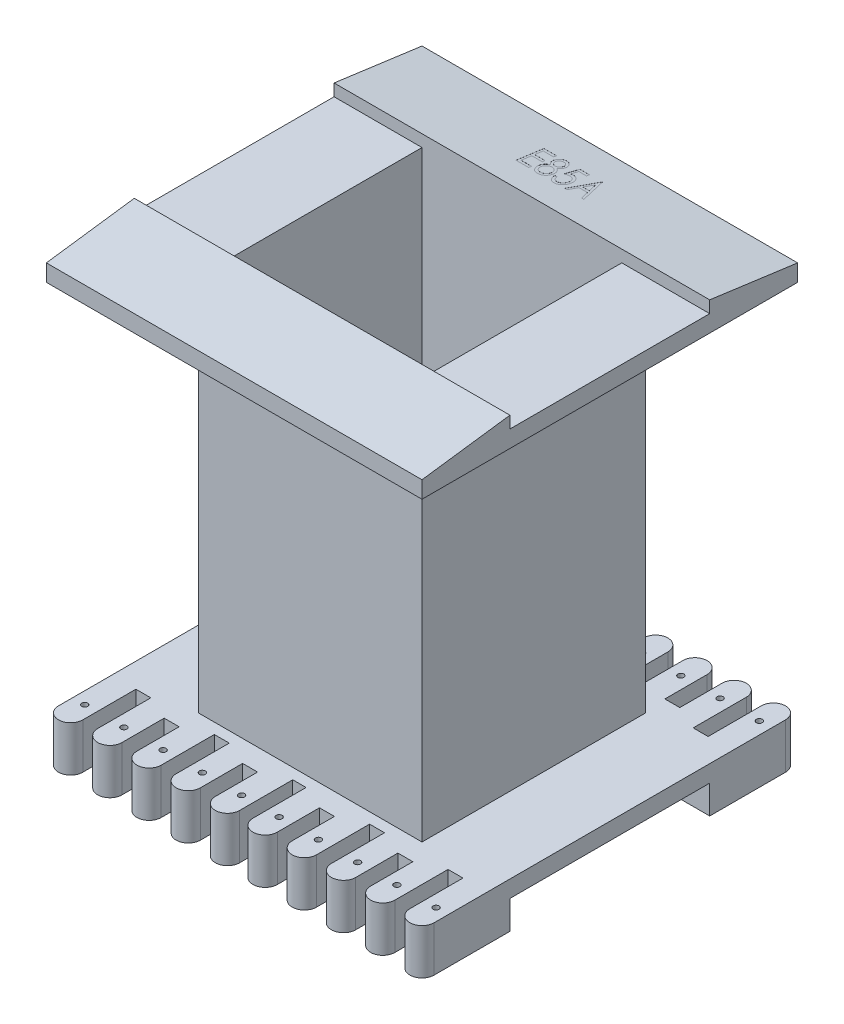
from build123d import *

# Parameters (mm, degrees)
SKETCH2_W           = 31.8
SKETCH2_H           = 31.8
SKETCH2_W_2         = 28.4
SKETCH2_H_2         = 28.4
BOSS_EXTRUDE1_DEPTH = 26.5
SKETCH4_W           = 53.4
SKETCH4_H           = 53.4
SKETCH4_W_2         = 28.4
SKETCH4_H_2         = 28.4
BOSS_EXTRUDE2_DEPTH = 2.4
BOSS_EXTRUDE3_DEPTH = 26.7
SKETCH7_R           = 0.425
CUT_EXTRUDE1_DEPTH  = 3
BOSS_EXTRUDE4_START = 4.05
BOSS_EXTRUDE4_DEPTH = 4.05
CUT_EXTRUDE2_DEPTH  = 0.01


with BuildPart() as part:
    # Sketch2 → Boss-Extrude1 (new, symmetric)
    with BuildSketch(Plane(origin=(0, 0, 0), x_dir=(1, 0, 0), z_dir=(0, 1, 0))):
        Rectangle(SKETCH2_W, SKETCH2_H)
        Rectangle(SKETCH2_W_2, SKETCH2_H_2, mode=Mode.SUBTRACT)
    extrude(amount=BOSS_EXTRUDE1_DEPTH, both=True)

    # Sketch4 → Boss-Extrude2 (add)
    with BuildSketch(Plane(origin=(0, 26.5, 0), x_dir=(1, 0, 0), z_dir=(0, 1, 0))):
        Rectangle(SKETCH4_W, SKETCH4_H)
        Rectangle(SKETCH4_W_2, SKETCH4_H_2, mode=Mode.SUBTRACT)
    boss_extrude2 = extrude(amount=BOSS_EXTRUDE2_DEPTH)

    # Mirror1: Boss-Extrude2 across plane
    add(boss_extrude2.mirror(Plane.ZX))

    # Sketch5 → Boss-Extrude3 (add, symmetric)
    with BuildSketch(Plane(origin=(0, 0, 0), x_dir=(0, 0, -1), z_dir=(1, 0, 0))):
        Polygon((-26.7, 28.9), (-14.2, 30.6), (-14.2, 28.9), align=None)
        Polygon((14.2, 30.6), (14.2, 28.9), (26.7, 28.9), align=None)
    extrude(amount=BOSS_EXTRUDE3_DEPTH, both=True)

    # Sketch7 → Cut-Extrude1 (cut)
    with BuildSketch(Plane.XZ.offset(28.9)):
        with Locations((-24.975, 22.975)):
            Circle(SKETCH7_R)
        with Locations((-19.4, 22.975)):
            Circle(SKETCH7_R)
        with Locations((-13.825, 22.975)):
            Circle(SKETCH7_R)
        with Locations((-8.25, 22.975)):
            Circle(SKETCH7_R)
        with Locations((-2.675, 22.975)):
            Circle(SKETCH7_R)
        with Locations((19.4, 22.975)):
            Circle(SKETCH7_R)
        with Locations((13.825, 22.975)):
            Circle(SKETCH7_R)
        with Locations((8.25, 22.975)):
            Circle(SKETCH7_R)
        with Locations((2.675, 22.975)):
            Circle(SKETCH7_R)
        with Locations((24.975, 22.975)):
            Circle(SKETCH7_R)
        with Locations((24.975, -22.975)):
            Circle(SKETCH7_R)
        with Locations((2.675, -22.975)):
            Circle(SKETCH7_R)
        with Locations((8.25, -22.975)):
            Circle(SKETCH7_R)
        with Locations((13.825, -22.975)):
            Circle(SKETCH7_R)
        with Locations((19.4, -22.975)):
            Circle(SKETCH7_R)
        with Locations((-2.675, -22.975)):
            Circle(SKETCH7_R)
        with Locations((-8.25, -22.975)):
            Circle(SKETCH7_R)
        with Locations((-13.825, -22.975)):
            Circle(SKETCH7_R)
        with Locations((-19.4, -22.975)):
            Circle(SKETCH7_R)
        with Locations((-24.975, -22.975)):
            Circle(SKETCH7_R)
        with BuildLine():
            Line((-26.7, 26.7), (-26.7, 24.975))
            ThreePointArc((-26.7, 24.975), (-24.975, 26.7), (-23.25, 24.975))
            Line((-23.25, 24.975), (-23.25, 17.425))
            Line((-23.25, 17.425), (-21.125, 17.425))
            Line((-21.125, 17.425), (-21.125, 24.975))
            ThreePointArc((-21.125, 24.975), (-19.4, 26.7), (-17.675, 24.975))
            Line((-17.675, 24.975), (-17.675, 18.975))
            Line((-17.675, 18.975), (-15.55, 18.975))
            Line((-15.55, 18.975), (-15.55, 24.975))
            ThreePointArc((-15.55, 24.975), (-13.825, 26.7), (-12.1, 24.975))
            Line((-12.1, 24.975), (-12.1, 17.425))
            Line((-12.1, 17.425), (-9.975, 17.425))
            Line((-9.975, 17.425), (-9.975, 24.975))
            ThreePointArc((-9.975, 24.975), (-8.25, 26.7), (-6.525, 24.975))
            Line((-6.525, 24.975), (-6.525, 18.975))
            Line((-6.525, 18.975), (-4.4, 18.975))
            Line((-4.4, 18.975), (-4.4, 24.975))
            ThreePointArc((-4.4, 24.975), (-2.675, 26.7), (-0.95, 24.975))
            Line((-0.95, 24.975), (-0.95, 17.425))
            Line((-0.95, 17.425), (0.95, 17.425))
            Line((0.95, 17.425), (0.95, 24.975))
            ThreePointArc((0.95, 24.975), (2.675, 26.7), (4.4, 24.975))
            Line((4.4, 24.975), (4.4, 18.975))
            Line((4.4, 18.975), (6.525, 18.975))
            Line((6.525, 18.975), (6.525, 24.975))
            ThreePointArc((6.525, 24.975), (8.25, 26.7), (9.975, 24.975))
            Line((9.975, 24.975), (9.975, 17.425))
            Line((9.975, 17.425), (12.1, 17.425))
            Line((12.1, 17.425), (12.1, 24.975))
            ThreePointArc((12.1, 24.975), (13.825, 26.7), (15.55, 24.975))
            Line((15.55, 24.975), (15.55, 18.975))
            Line((15.55, 18.975), (17.675, 18.975))
            Line((17.675, 18.975), (17.675, 24.975))
            ThreePointArc((17.675, 24.975), (19.4, 26.7), (21.125, 24.975))
            Line((21.125, 24.975), (21.125, 17.425))
            Line((21.125, 17.425), (23.25, 17.425))
            Line((23.25, 17.425), (23.25, 24.975))
            ThreePointArc((23.25, 24.975), (24.975, 26.7), (26.7, 24.975))
            Line((26.7, 24.975), (26.7, 27.95))
            Line((26.7, 27.95), (-26.7, 27.95))
            Line((-26.7, 27.95), (-26.7, 26.7))
        make_face()
        with BuildLine():
            Line((0.95, -17.425), (0.95, -24.975))
            ThreePointArc((0.95, -24.975), (2.675, -26.7), (4.4, -24.975))
            Line((4.4, -24.975), (4.4, -18.975))
            Line((4.4, -18.975), (6.525, -18.975))
            Line((6.525, -18.975), (6.525, -24.975))
            ThreePointArc((6.525, -24.975), (8.25, -26.7), (9.975, -24.975))
            Line((9.975, -24.975), (9.975, -17.425))
            Line((9.975, -17.425), (12.1, -17.425))
            Line((12.1, -17.425), (12.1, -24.975))
            ThreePointArc((12.1, -24.975), (13.825, -26.7), (15.55, -24.975))
            Line((15.55, -24.975), (15.55, -18.975))
            Line((15.55, -18.975), (17.675, -18.975))
            Line((17.675, -18.975), (17.675, -24.975))
            ThreePointArc((17.675, -24.975), (19.4, -26.7), (21.125, -24.975))
            Line((21.125, -24.975), (21.125, -17.425))
            Line((21.125, -17.425), (23.25, -17.425))
            Line((23.25, -17.425), (23.25, -24.975))
            ThreePointArc((23.25, -24.975), (24.975, -26.7), (26.7, -24.975))
            Line((26.7, -24.975), (26.7, -27.95))
            Line((26.7, -27.95), (-26.7, -27.95))
            Line((-26.7, -27.95), (-26.7, -26.7))
            Line((-26.7, -26.7), (-26.7, -24.975))
            ThreePointArc((-26.7, -24.975), (-24.975, -26.7), (-23.25, -24.975))
            Line((-23.25, -24.975), (-23.25, -17.425))
            Line((-23.25, -17.425), (-21.125, -17.425))
            Line((-21.125, -17.425), (-21.125, -24.975))
            ThreePointArc((-21.125, -24.975), (-19.4, -26.7), (-17.675, -24.975))
            Line((-17.675, -24.975), (-17.675, -18.975))
            Line((-17.675, -18.975), (-15.55, -18.975))
            Line((-15.55, -18.975), (-15.55, -24.975))
            ThreePointArc((-15.55, -24.975), (-13.825, -26.7), (-12.1, -24.975))
            Line((-12.1, -24.975), (-12.1, -17.425))
            Line((-12.1, -17.425), (-9.975, -17.425))
            Line((-9.975, -17.425), (-9.975, -24.975))
            ThreePointArc((-9.975, -24.975), (-8.25, -26.7), (-6.525, -24.975))
            Line((-6.525, -24.975), (-6.525, -18.975))
            Line((-6.525, -18.975), (-4.4, -18.975))
            Line((-4.4, -18.975), (-4.4, -24.975))
            ThreePointArc((-4.4, -24.975), (-2.675, -26.7), (-0.95, -24.975))
            Line((-0.95, -24.975), (-0.95, -17.425))
            Line((-0.95, -17.425), (0.95, -17.425))
        make_face()
    extrude(amount=-CUT_EXTRUDE1_DEPTH, mode=Mode.SUBTRACT)

    # Sketch8 → Boss-Extrude4 (add)
    with BuildSketch(Plane.XZ.offset(28.9).offset(BOSS_EXTRUDE4_START)):
        with BuildLine():
            Line((-26.7, 14.2), (26.7, 14.2))
            Line((26.7, 14.2), (26.7, 24.975))
            ThreePointArc((26.7, 24.975), (24.975, 26.7), (23.25, 24.975))
            Line((23.25, 24.975), (23.25, 17.425))
            Line((23.25, 17.425), (21.125, 17.425))
            Line((21.125, 17.425), (21.125, 24.975))
            ThreePointArc((21.125, 24.975), (19.4, 26.7), (17.675, 24.975))
            Line((17.675, 24.975), (17.675, 18.975))
            Line((17.675, 18.975), (15.55, 18.975))
            Line((15.55, 18.975), (15.55, 24.975))
            ThreePointArc((15.55, 24.975), (13.825, 26.7), (12.1, 24.975))
            Line((12.1, 24.975), (12.1, 17.425))
            Line((12.1, 17.425), (9.975, 17.425))
            Line((9.975, 17.425), (9.975, 24.975))
            ThreePointArc((9.975, 24.975), (8.25, 26.7), (6.525, 24.975))
            Line((6.525, 24.975), (6.525, 18.975))
            Line((6.525, 18.975), (4.4, 18.975))
            Line((4.4, 18.975), (4.4, 24.975))
            ThreePointArc((4.4, 24.975), (2.675, 26.7), (0.95, 24.975))
            Line((0.95, 24.975), (0.95, 17.425))
            Line((0.95, 17.425), (-0.95, 17.425))
            Line((-0.95, 17.425), (-0.95, 24.975))
            ThreePointArc((-0.95, 24.975), (-2.675, 26.7), (-4.4, 24.975))
            Line((-4.4, 24.975), (-4.4, 18.975))
            Line((-4.4, 18.975), (-6.525, 18.975))
            Line((-6.525, 18.975), (-6.525, 24.975))
            ThreePointArc((-6.525, 24.975), (-8.25, 26.7), (-9.975, 24.975))
            Line((-9.975, 24.975), (-9.975, 17.425))
            Line((-9.975, 17.425), (-12.1, 17.425))
            Line((-12.1, 17.425), (-12.1, 24.975))
            ThreePointArc((-12.1, 24.975), (-13.825, 26.7), (-15.55, 24.975))
            Line((-15.55, 24.975), (-15.55, 18.975))
            Line((-15.55, 18.975), (-17.675, 18.975))
            Line((-17.675, 18.975), (-17.675, 24.975))
            ThreePointArc((-17.675, 24.975), (-19.4, 26.7), (-21.125, 24.975))
            Line((-21.125, 24.975), (-21.125, 17.425))
            Line((-21.125, 17.425), (-23.25, 17.425))
            Line((-23.25, 17.425), (-23.25, 24.975))
            ThreePointArc((-23.25, 24.975), (-24.975, 26.7), (-26.7, 24.975))
            Line((-26.7, 24.975), (-26.7, 14.2))
        make_face()
        with BuildLine():
            Line((-26.7, -24.975), (-26.7, -14.2))
            Line((-26.7, -14.2), (26.7, -14.2))
            Line((26.7, -14.2), (26.7, -24.975))
            ThreePointArc((26.7, -24.975), (24.975, -26.7), (23.25, -24.975))
            Line((23.25, -24.975), (23.25, -17.425))
            Line((23.25, -17.425), (21.125, -17.425))
            Line((21.125, -17.425), (21.125, -24.975))
            ThreePointArc((21.125, -24.975), (19.4, -26.7), (17.675, -24.975))
            Line((17.675, -24.975), (17.675, -18.975))
            Line((17.675, -18.975), (15.55, -18.975))
            Line((15.55, -18.975), (15.55, -24.975))
            ThreePointArc((15.55, -24.975), (13.825, -26.7), (12.1, -24.975))
            Line((12.1, -24.975), (12.1, -17.425))
            Line((12.1, -17.425), (9.975, -17.425))
            Line((9.975, -17.425), (9.975, -24.975))
            ThreePointArc((9.975, -24.975), (8.25, -26.7), (6.525, -24.975))
            Line((6.525, -24.975), (6.525, -18.975))
            Line((6.525, -18.975), (4.4, -18.975))
            Line((4.4, -18.975), (4.4, -24.975))
            ThreePointArc((4.4, -24.975), (2.675, -26.7), (0.95, -24.975))
            Line((0.95, -24.975), (0.95, -17.425))
            Line((0.95, -17.425), (-0.95, -17.425))
            Line((-0.95, -17.425), (-0.95, -24.975))
            ThreePointArc((-0.95, -24.975), (-2.675, -26.7), (-4.4, -24.975))
            Line((-4.4, -24.975), (-4.4, -18.975))
            Line((-4.4, -18.975), (-6.525, -18.975))
            Line((-6.525, -18.975), (-6.525, -24.975))
            ThreePointArc((-6.525, -24.975), (-8.25, -26.7), (-9.975, -24.975))
            Line((-9.975, -24.975), (-9.975, -17.425))
            Line((-9.975, -17.425), (-12.1, -17.425))
            Line((-12.1, -17.425), (-12.1, -24.975))
            ThreePointArc((-12.1, -24.975), (-13.825, -26.7), (-15.55, -24.975))
            Line((-15.55, -24.975), (-15.55, -18.975))
            Line((-15.55, -18.975), (-17.675, -18.975))
            Line((-17.675, -18.975), (-17.675, -24.975))
            ThreePointArc((-17.675, -24.975), (-19.4, -26.7), (-21.125, -24.975))
            Line((-21.125, -24.975), (-21.125, -17.425))
            Line((-21.125, -17.425), (-23.25, -17.425))
            Line((-23.25, -17.425), (-23.25, -24.975))
            ThreePointArc((-23.25, -24.975), (-24.975, -26.7), (-26.7, -24.975))
        make_face()
    extrude(amount=-BOSS_EXTRUDE4_DEPTH)

    # Sketch9 → Cut-Extrude2 (cut)
    # profile 1 of 4: a face of its own
    with BuildSketch(Plane(origin=(0, 31.94042981, -4.343898454), x_dir=(1, 0, 0), z_dir=(0, 0.9908783423839452, -0.13475945456421662))):
        Polygon((-4.794871795, 17.946833152), (-3, 17.946833152), (-3, 17.536576742), (-4.487179487, 17.536576742), (-4.487179487, 16.305807511), (-3, 16.305807511), (-3, 15.895551101), (-4.487179487, 15.895551101), (-4.487179487, 14.357089562), (-3, 14.357089562), (-3, 13.946833152), (-4.794871795, 13.946833152), align=None)
    # profile 2 of 4: a face of its own
    with BuildSketch(Plane(origin=(0, 31.94042981, -4.343898454), x_dir=(1, 0, 0), z_dir=(0, 0.9908783423839452, -0.13475945456421662))):
        with BuildLine():
            add(Edge.make_bspline(
                [(-1.185096154, 16.175198537), (-1.135626284, 16.141056591), (-1.04005113, 16.075094787), (-0.914790112, 15.960788774), (-0.810265914, 15.839953271), (-0.728041652, 15.710316771), (-0.665735209, 15.573158313), (-0.621571795, 15.427435632), (-0.594527612, 15.272624301), (-0.591360756, 15.166228587), (-0.58974359, 15.111897255)],
                knots=[0, 0, 0, 0, 1.128817125, 2.180860238, 3.177988592, 4.123737061, 5.056171269, 6.001159785, 6.979285454, 8, 8, 8, 8], degree=3))
            add(Edge.make_bspline(
                [(-0.58974359, 15.111897255), (-0.59064271, 15.073416372), (-0.592419208, 14.997385205), (-0.602642688, 14.884853435), (-0.621142605, 14.77589293), (-0.647046954, 14.670185914), (-0.679464719, 14.5679622), (-0.720106353, 14.469182218), (-0.76781206, 14.374069571), (-0.805107424, 14.313564078), (-0.823717949, 14.283371614)],
                knots=[0, 0, 0, 0, 1.057772661, 2.089964817, 3.102547595, 4.092524029, 5.079228706, 6.047156722, 7.025523981, 8, 8, 8, 8], degree=3))
            add(Edge.make_bspline(
                [(-0.823717949, 14.283371614), (-0.848331695, 14.24858759), (-0.896545895, 14.180451521), (-0.980326536, 14.090330734), (-1.071832239, 14.013614971), (-1.171885186, 13.951806315), (-1.279365151, 13.903349482), (-1.394289356, 13.868550742), (-1.517199317, 13.848578888), (-1.601690308, 13.845730302), (-1.645032051, 13.84426905)],
                knots=[0, 0, 0, 0, 1.048906327, 2.054631539, 3.021839926, 3.982309668, 4.942418687, 5.918716991, 6.932354415, 8, 8, 8, 8], degree=3))
            add(Edge.make_bspline(
                [(-1.645032051, 13.84426905), (-1.686755969, 13.845578261), (-1.767918209, 13.848124965), (-1.886102142, 13.865652649), (-1.995989766, 13.896219672), (-2.098668658, 13.937965954), (-2.192974343, 13.993169036), (-2.279823877, 14.059765922), (-2.358694892, 14.138752147), (-2.42790694, 14.229091764), (-2.489619851, 14.326028876), (-2.54350424, 14.426590179), (-2.589289403, 14.529427296), (-2.62730228, 14.634542595), (-2.656033908, 14.742393782), (-2.676777414, 14.852460047), (-2.690262242, 14.964927669), (-2.691622402, 15.040811869), (-2.692307692, 15.079044691)],
                knots=[0, 0, 0, 0, 1.104708739, 2.14890257, 3.154370595, 4.118367704, 5.075413289, 6.038709714, 7.008861323, 8.021763411, 9.045837506, 10.048840199, 11.039777576, 12.024055369, 13.005330523, 13.991512021, 14.988061252, 16, 16, 16, 16], degree=3))
            add(Edge.make_bspline(
                [(-2.692307692, 15.079044691), (-2.690667664, 15.134434789), (-2.68745512, 15.242934788), (-2.660659375, 15.401356531), (-2.615114723, 15.550656294), (-2.563811585, 15.668914986), (-2.512761874, 15.75856408), (-2.468221188, 15.823664599), (-2.41849553, 15.887406662), (-2.362107521, 15.948574713), (-2.301387434, 16.009058212), (-2.234270156, 16.066890425), (-2.161758858, 16.122791063), (-2.11023677, 16.157575846), (-2.084134615, 16.175198537)],
                knots=[0, 0, 0, 0, 1.517674003, 2.972871206, 4.388029641, 5.787820883, 6.496147795, 7.212975084, 7.948222945, 8.710108948, 9.49185787, 10.296315951, 11.136878426, 12, 12, 12, 12], degree=3))
            add(Edge.make_bspline(
                [(-2.084134615, 16.175198537), (-2.1204404, 16.200676675), (-2.191744723, 16.250715572), (-2.283763742, 16.341173875), (-2.363876067, 16.438473636), (-2.427598718, 16.545578043), (-2.477370021, 16.658722209), (-2.512814344, 16.77657027), (-2.534212316, 16.898511285), (-2.537035894, 16.981203206), (-2.538461538, 17.022954947)],
                knots=[0, 0, 0, 0, 1.058972266, 2.079814596, 3.074322664, 4.065626078, 5.049411374, 6.023340544, 7.001970524, 8, 8, 8, 8], degree=3))
            add(Edge.make_bspline(
                [(-2.538461538, 17.022954947), (-2.537250877, 17.065546678), (-2.534826501, 17.150837483), (-2.509490862, 17.277377064), (-2.473659219, 17.403179659), (-2.420052602, 17.524631516), (-2.356128477, 17.640327157), (-2.277408793, 17.743718972), (-2.187838154, 17.834424953), (-2.087745442, 17.911072886), (-1.980063581, 17.973430851), (-1.86570671, 18.016473242), (-1.747607768, 18.044496498), (-1.6670907, 18.04775747), (-1.626602564, 18.049397255)],
                knots=[0, 0, 0, 0, 1.006801535, 2.016140496, 3.04434944, 4.097767983, 5.150882958, 6.16620321, 7.163091172, 8.159497914, 9.142029795, 10.096562843, 11.042853592, 12, 12, 12, 12], degree=3))
            add(Edge.make_bspline(
                [(-1.626602564, 18.049397255), (-1.586927915, 18.047727927), (-1.50828014, 18.044418787), (-1.392872522, 18.017021494), (-1.283001498, 17.971343283), (-1.178853838, 17.909254748), (-1.081763115, 17.83274871), (-0.996006953, 17.740978796), (-0.919694516, 17.637969958), (-0.857553258, 17.522818099), (-0.807170964, 17.40056479), (-0.770066589, 17.273897116), (-0.747708729, 17.143672464), (-0.744968292, 17.055893364), (-0.743589744, 17.011736998)],
                knots=[0, 0, 0, 0, 0.945268751, 1.87382339, 2.810620796, 3.772987939, 4.756784404, 5.747996242, 6.759505551, 7.805656055, 8.859553138, 9.907698875, 10.947489625, 12, 12, 12, 12], degree=3))
            add(Edge.make_bspline(
                [(-0.743589744, 17.011736998), (-0.74508208, 16.96840226), (-0.748000338, 16.883661357), (-0.767722762, 16.759812765), (-0.80368054, 16.64384312), (-0.851869477, 16.534637948), (-0.913792032, 16.432544739), (-0.991704326, 16.339322193), (-1.080947463, 16.250943489), (-1.149923897, 16.200778512), (-1.185096154, 16.175198537)],
                knots=[0, 0, 0, 0, 1.053501153, 2.060117211, 3.037794984, 3.997036466, 4.955838333, 5.929389179, 6.944160328, 8, 8, 8, 8], degree=3))
        make_face()
        with BuildLine():
            add(Edge.make_bspline(
                [(-1.641826923, 17.639140844), (-1.662678905, 17.638402398), (-1.703467153, 17.636957933), (-1.763494128, 17.629218021), (-1.82055157, 17.614386077), (-1.87547098, 17.594810697), (-1.926699457, 17.567534224), (-1.976294575, 17.536683208), (-2.021917258, 17.498279376), (-2.078811567, 17.441471512), (-2.139655068, 17.361661437), (-2.192601817, 17.254855601), (-2.225176639, 17.138895775), (-2.228879214, 17.058423739), (-2.230769231, 17.017345973)],
                knots=[0, 0, 0, 0, 0.787074358, 1.539584277, 2.277719126, 3.007830531, 3.733477235, 4.463101644, 5.207606632, 5.977196966, 7.494883027, 8.968605234, 10.452593816, 12, 12, 12, 12], degree=3))
            add(Edge.make_bspline(
                [(-2.230769231, 17.017345973), (-2.228665957, 16.976239157), (-2.224482932, 16.894485226), (-2.188867873, 16.77541559), (-2.132035496, 16.662496247), (-2.06664942, 16.576633955), (-2.007012568, 16.51320049), (-1.959078513, 16.471395948), (-1.908625945, 16.436545535), (-1.85683746, 16.407800217), (-1.803255728, 16.3847666), (-1.747788553, 16.368919548), (-1.690270484, 16.358837761), (-1.651217522, 16.357677855), (-1.631410256, 16.357089562)],
                knots=[0, 0, 0, 0, 1.503377697, 2.989943038, 4.512810598, 6.113657223, 6.923460787, 7.700377033, 8.438683534, 9.16575144, 9.867283722, 10.570247634, 11.274844133, 12, 12, 12, 12], degree=3))
            add(Edge.make_bspline(
                [(-1.631410256, 16.357089562), (-1.606196254, 16.358099133), (-1.555679017, 16.360121846), (-1.481427597, 16.37879579), (-1.409376955, 16.40784305), (-1.340505481, 16.448300462), (-1.275827454, 16.498121943), (-1.218726845, 16.55831185), (-1.168468483, 16.626290838), (-1.126631667, 16.701877917), (-1.09368888, 16.781657004), (-1.069129611, 16.862632371), (-1.054125349, 16.943870285), (-1.052225424, 16.998321851), (-1.051282051, 17.025358793)],
                knots=[0, 0, 0, 0, 0.926959826, 1.857200198, 2.801319747, 3.77959719, 4.788725481, 5.797230661, 6.823935113, 7.893723746, 8.969417254, 9.996121706, 11.005010385, 12, 12, 12, 12], degree=3))
            add(Edge.make_bspline(
                [(-1.051282051, 17.025358793), (-1.053161529, 17.062924049), (-1.056893494, 17.137515102), (-1.086111821, 17.246722482), (-1.134580984, 17.350647847), (-1.189027327, 17.431916831), (-1.241693246, 17.491441387), (-1.286152831, 17.531251289), (-1.334999432, 17.564654529), (-1.387986913, 17.592831335), (-1.445735382, 17.612864339), (-1.507300952, 17.628632351), (-1.5732138, 17.637159563), (-1.618567984, 17.638469216), (-1.641826923, 17.639140844)],
                knots=[0, 0, 0, 0, 1.41789026, 2.815418751, 4.237647105, 5.734964885, 6.492513555, 7.235814941, 7.983146572, 8.723359292, 9.495815479, 10.286317727, 11.121174114, 12, 12, 12, 12], degree=3))
        make_face(mode=Mode.SUBTRACT)
        with BuildLine():
            add(Edge.make_bspline(
                [(-1.625, 15.946833152), (-1.65151015, 15.946208302), (-1.703521085, 15.944982394), (-1.779607047, 15.930973817), (-1.852853842, 15.911818819), (-1.922621411, 15.882126066), (-1.989125385, 15.844623693), (-2.052035627, 15.798026565), (-2.112337363, 15.744556402), (-2.167780198, 15.682787063), (-2.218571481, 15.616410029), (-2.262946944, 15.546082173), (-2.300775648, 15.473277765), (-2.331270711, 15.397250494), (-2.3555483, 15.318789448), (-2.372073535, 15.237171194), (-2.383044784, 15.153062692), (-2.384088156, 15.095906956), (-2.384615385, 15.06702546)],
                knots=[0, 0, 0, 0, 0.9847572, 1.932020036, 2.869543467, 3.795734653, 4.743309996, 5.703045184, 6.702129772, 7.735926045, 8.785026717, 9.807544264, 10.825030468, 11.832280622, 12.85044557, 13.875276944, 14.92635129, 16, 16, 16, 16], degree=3))
            add(Edge.make_bspline(
                [(-2.384615385, 15.06702546), (-2.383664751, 15.031150106), (-2.381787006, 14.960287092), (-2.362859469, 14.855617419), (-2.334711629, 14.753706238), (-2.293421554, 14.656383429), (-2.243560417, 14.56523028), (-2.181220632, 14.485216706), (-2.111757652, 14.414347536), (-2.031490856, 14.356705176), (-1.944013646, 14.310418264), (-1.84888696, 14.278865883), (-1.747732644, 14.257627411), (-1.677731807, 14.255577105), (-1.641826923, 14.25452546)],
                knots=[0, 0, 0, 0, 1.046503232, 2.067112015, 3.096621624, 4.12790218, 5.147527128, 6.120914979, 7.080488514, 8.035200521, 8.994520469, 9.958867953, 10.953060937, 12, 12, 12, 12], degree=3))
            add(Edge.make_bspline(
                [(-1.641826923, 14.25452546), (-1.614000863, 14.255245152), (-1.559679327, 14.256650122), (-1.480434778, 14.269096485), (-1.405561893, 14.288799944), (-1.33540054, 14.317438855), (-1.268730332, 14.352585495), (-1.207344684, 14.397133706), (-1.149415402, 14.44863533), (-1.098513051, 14.509012304), (-1.051110681, 14.573244288), (-1.010609789, 14.641780389), (-0.974680423, 14.712037272), (-0.947142874, 14.78567401), (-0.923841724, 14.861174913), (-0.909463614, 14.940011948), (-0.899104892, 15.021345483), (-0.897998233, 15.076605821), (-0.897435897, 15.104685716)],
                knots=[0, 0, 0, 0, 1.057208993, 2.063864431, 3.041686247, 3.993867019, 4.938765438, 5.899569259, 6.870141775, 7.877872017, 8.895376391, 9.901878192, 10.900874436, 11.890851383, 12.886746751, 13.900342611, 14.933083623, 16, 16, 16, 16], degree=3))
            add(Edge.make_bspline(
                [(-0.897435897, 15.104685716), (-0.897924631, 15.131972735), (-0.89888668, 15.185686042), (-0.910344564, 15.264861308), (-0.925671947, 15.342029343), (-0.949150056, 15.416906555), (-0.979853384, 15.489149206), (-1.016839264, 15.559120213), (-1.060325784, 15.626627201), (-1.109634942, 15.690928781), (-1.163270948, 15.750701834), (-1.221136347, 15.802901456), (-1.281452612, 15.847355507), (-1.344477698, 15.883929885), (-1.410673709, 15.912205365), (-1.479842369, 15.932111673), (-1.551632484, 15.944601112), (-1.600376633, 15.946084042), (-1.625, 15.946833152)],
                knots=[0, 0, 0, 0, 1.062772706, 2.092021773, 3.112970097, 4.127207538, 5.144326494, 6.168931198, 7.208606358, 8.270613836, 9.324630021, 10.334529776, 11.302840154, 12.240380969, 13.168626316, 14.101066092, 15.040743392, 16, 16, 16, 16], degree=3))
        make_face(mode=Mode.SUBTRACT)
    # profile 3 of 4: a face of its own
    with BuildSketch(Plane(origin=(0, 31.94042981, -4.343898454), x_dir=(1, 0, 0), z_dir=(0, 0.9908783423839452, -0.13475945456421662))):
        with BuildLine():
            Line((1.666666667, 17.946833152), (1.666666667, 17.536576742))
            Line((1.666666667, 17.536576742), (0.582532051, 17.536576742))
            Line((0.582532051, 17.536576742), (0.420673077, 16.48128828))
            add(Edge.make_bspline(
                [(0.420673077, 16.48128828), (0.453617749, 16.493576108), (0.517175224, 16.517282013), (0.611750519, 16.54287006), (0.701606708, 16.559406831), (0.760084117, 16.561299371), (0.788461538, 16.562217768)],
                knots=[0, 0, 0, 0, 1.113577535, 2.148334562, 3.101439487, 4, 4, 4, 4], degree=3))
            add(Edge.make_bspline(
                [(0.788461538, 16.562217768), (0.823266725, 16.561261816), (0.891740394, 16.559381133), (0.992021095, 16.54082834), (1.087852896, 16.512162002), (1.178924637, 16.471917203), (1.26500229, 16.419842685), (1.345957709, 16.355811854), (1.423466548, 16.281251809), (1.493898732, 16.194498165), (1.5584294, 16.099977306), (1.614984032, 15.99802962), (1.662806587, 15.889926493), (1.702692059, 15.775390791), (1.731688646, 15.653910303), (1.753144296, 15.526219156), (1.767491707, 15.392136525), (1.768643015, 15.300503658), (1.769230769, 15.253724178)],
                knots=[0, 0, 0, 0, 0.915452749, 1.801007638, 2.675239231, 3.544138018, 4.414827501, 5.316484203, 6.256349044, 7.24041834, 8.25264956, 9.266198822, 10.305020537, 11.361306631, 12.454513165, 13.588568039, 14.768940248, 16, 16, 16, 16], degree=3))
            add(Edge.make_bspline(
                [(1.769230769, 15.253724178), (1.767666555, 15.188986692), (1.764588309, 15.061588592), (1.736443679, 14.87499519), (1.69151676, 14.696441904), (1.629702124, 14.527917078), (1.552841282, 14.37270686), (1.461871583, 14.235400622), (1.35885148, 14.11611107), (1.260456918, 14.034639724), (1.178009436, 13.97773927), (1.112648947, 13.943204356), (1.045883059, 13.911927267), (0.976262367, 13.887521397), (0.904529838, 13.867931978), (0.830227331, 13.854706087), (0.753717965, 13.845195254), (0.701686145, 13.84457928), (0.675480769, 13.84426905)],
                knots=[0, 0, 0, 0, 1.560107059, 3.070163622, 4.538401596, 5.993174223, 7.390017185, 8.704628562, 9.955064718, 11.175437472, 11.773810098, 12.367450782, 12.955334644, 13.550126979, 14.143767662, 14.746284672, 15.368577114, 16, 16, 16, 16], degree=3))
            add(Edge.make_bspline(
                [(0.675480769, 13.84426905), (0.644156666, 13.84506331), (0.5824586, 13.846627739), (0.492325901, 13.862883748), (0.4054898, 13.886488845), (0.322800471, 13.921402732), (0.243361593, 13.96582201), (0.168357606, 14.020747035), (0.096177778, 14.084367097), (0.02957855, 14.158323114), (-0.032668997, 14.239305898), (-0.08795816, 14.327262561), (-0.137210194, 14.420661428), (-0.179280556, 14.519995454), (-0.215660161, 14.624870121), (-0.245213802, 14.735434553), (-0.267689049, 14.851957738), (-0.277204527, 14.931804062), (-0.282051282, 14.972474178)],
                knots=[0, 0, 0, 0, 0.923275421, 1.818545566, 2.694317439, 3.573945876, 4.459590681, 5.373909434, 6.311768093, 7.29356341, 8.305513485, 9.322178447, 10.355055801, 11.417807359, 12.501966515, 13.627940912, 14.791780093, 16, 16, 16, 16], degree=3))
            Line((-0.282051282, 14.972474178), (0.025641026, 14.972474178))
            add(Edge.make_bspline(
                [(0.025641026, 14.972474178), (0.032197533, 14.934408075), (0.044729508, 14.861649294), (0.073133425, 14.75899499), (0.107151069, 14.667262363), (0.148132056, 14.585746514), (0.197187112, 14.514520263), (0.252177725, 14.450211574), (0.314704779, 14.393133354), (0.384472293, 14.344722537), (0.457997339, 14.304304475), (0.535388559, 14.27640354), (0.61394664, 14.257557727), (0.667361991, 14.255532186), (0.693910256, 14.25452546)],
                knots=[0, 0, 0, 0, 1.295040219, 2.475313703, 3.5669374, 4.572676558, 5.526934895, 6.460829183, 7.40583148, 8.357815864, 9.30383694, 10.210915259, 11.110796898, 12, 12, 12, 12], degree=3))
            add(Edge.make_bspline(
                [(0.693910256, 14.25452546), (0.71988254, 14.255472282), (0.771120406, 14.257340165), (0.846178643, 14.271499055), (0.918533239, 14.293825189), (0.987366587, 14.326735774), (1.054990616, 14.366425321), (1.117706105, 14.4180502), (1.179411436, 14.476478355), (1.236147531, 14.544451348), (1.288812528, 14.618558495), (1.335783442, 14.697804116), (1.373744225, 14.782572639), (1.406300242, 14.87102431), (1.430990782, 14.964143283), (1.448265091, 15.061723207), (1.460247288, 15.163683882), (1.461102289, 15.233389006), (1.461538462, 15.268948537)],
                knots=[0, 0, 0, 0, 0.883627968, 1.743212611, 2.591519239, 3.453888357, 4.334892888, 5.253609023, 6.211746337, 7.224577056, 8.261445484, 9.30467269, 10.354377667, 11.418591148, 12.510297713, 13.628489155, 14.790192039, 16, 16, 16, 16], degree=3))
            add(Edge.make_bspline(
                [(1.461538462, 15.268948537), (1.460953549, 15.301025022), (1.459810209, 15.363725519), (1.449996428, 15.455345283), (1.434147699, 15.54219671), (1.411647265, 15.624525181), (1.38267747, 15.702147116), (1.348466534, 15.775855602), (1.306455005, 15.844145678), (1.258302116, 15.907132511), (1.205982354, 15.965117264), (1.147987594, 16.015024321), (1.085316194, 16.056940474), (1.019173807, 16.092745207), (0.947731962, 16.11881528), (0.872684124, 16.138454169), (0.793063111, 16.149527829), (0.738547316, 16.151139299), (0.710737179, 16.151961357)],
                knots=[0, 0, 0, 0, 1.180781187, 2.308094721, 3.388266191, 4.428481563, 5.445995518, 6.435805344, 7.415746039, 8.391334499, 9.351887262, 10.286308742, 11.200059834, 12.123916071, 13.048190959, 13.992752428, 14.976043021, 16, 16, 16, 16], degree=3))
            add(Edge.make_bspline(
                [(0.710737179, 16.151961357), (0.686401663, 16.15131597), (0.636483764, 16.149992129), (0.559904844, 16.139692232), (0.479863999, 16.123705444), (0.396187651, 16.10090133), (0.308763677, 16.071915206), (0.217404595, 16.036415253), (0.122106409, 15.99496853), (0.058352979, 15.963156129), (0.025641026, 15.946833152)],
                knots=[0, 0, 0, 0, 0.80946005, 1.660394019, 2.566651373, 3.523765815, 4.543866754, 5.629776835, 6.783835928, 8, 8, 8, 8], degree=3))
            Line((0.025641026, 15.946833152), (0.333333333, 17.946833152))
            Line((0.333333333, 17.946833152), (1.666666667, 17.946833152))
        make_face()
    # profile 4 of 4: a face of its own
    with BuildSketch(Plane(origin=(0, 31.94042981, -4.343898454), x_dir=(1, 0, 0), z_dir=(0, 0.9908783423839452, -0.13475945456421662))):
        Polygon((3.512820513, 17.946833152), (4.846153846, 13.946833152), (4.511217949, 13.946833152), (4.084134615, 15.228884434), (2.890224359, 15.228884434), (2.463141026, 13.946833152), (2.128205128, 13.946833152), (3.461538462, 17.946833152), align=None)
        Polygon((3.487179487, 17.018948537), (3.02724359, 15.639140844), (3.947115385, 15.639140844), align=None, mode=Mode.SUBTRACT)
    extrude(amount=-CUT_EXTRUDE2_DEPTH, mode=Mode.SUBTRACT)


solid = part.part
